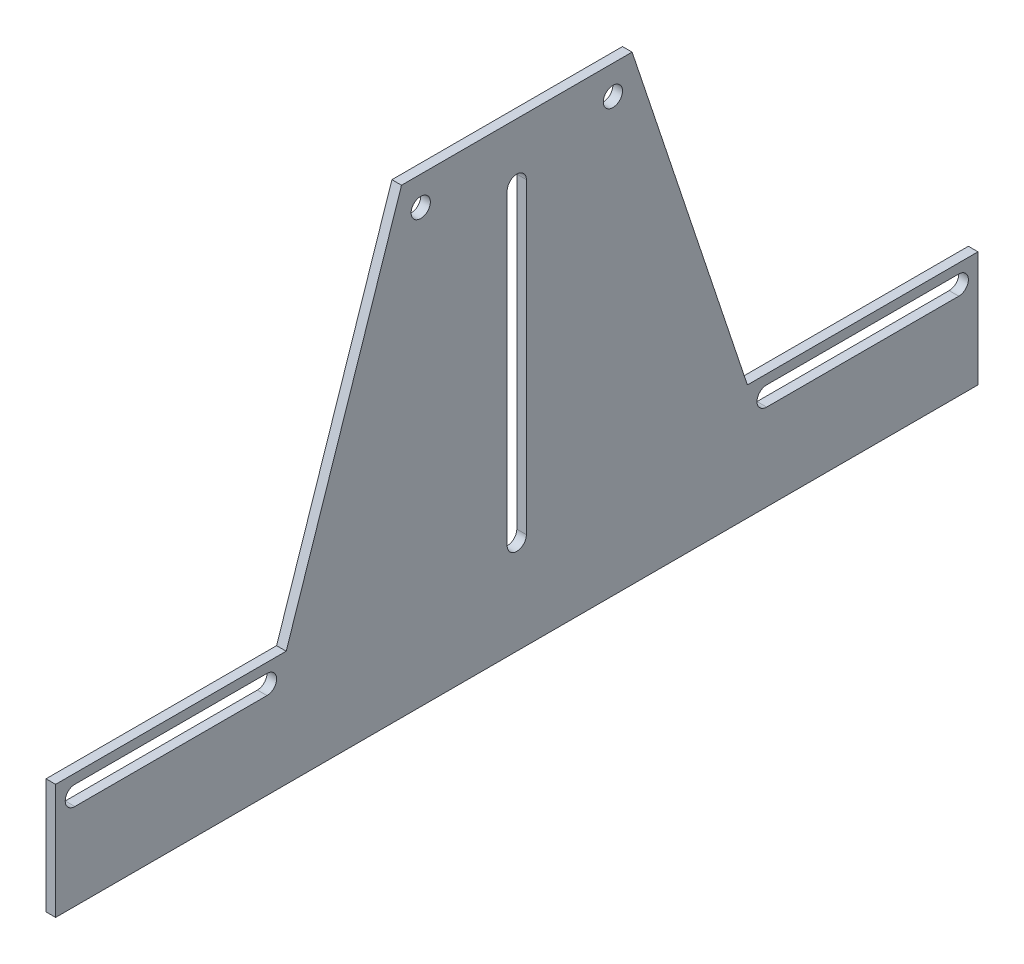
from build123d import *

# Parameters (mm, degrees)
SKETCH1_R           = 6.35
BOSS_EXTRUDE1_DEPTH = 6.35


with BuildPart() as part:
    # Sketch1 → Boss-Extrude1 (new body)
    with BuildSketch(Plane(origin=(0, 0, 0), x_dir=(0, 0, -1), z_dir=(1, 0, 0))):
        Polygon((304.8, 0), (-304.8, 0), (-304.8, 76.2), (-152.4, 76.2), (-76.2, 304.8), (76.2, 304.8), (152.4, 76.2), (304.8, 76.2), align=None)
        with Locations((-63.5, 285.75)):
            Circle(SKETCH1_R, mode=Mode.SUBTRACT)
        with Locations((63.5, 285.75)):
            Circle(SKETCH1_R, mode=Mode.SUBTRACT)
        with BuildLine():
            Line((-292.1, 69.85), (-165.1, 69.85))
            ThreePointArc((-165.1, 69.85), (-158.75, 63.5), (-165.1, 57.15))
            Line((-165.1, 57.15), (-292.1, 57.15))
            ThreePointArc((-292.1, 57.15), (-298.45, 63.5), (-292.1, 69.85))
        make_face(mode=Mode.SUBTRACT)
        with BuildLine():
            Line((292.1, 69.85), (165.1, 69.85))
            ThreePointArc((165.1, 69.85), (158.75, 63.5), (165.1, 57.15))
            Line((165.1, 57.15), (292.1, 57.15))
            ThreePointArc((292.1, 57.15), (298.45, 63.5), (292.1, 69.85))
        make_face(mode=Mode.SUBTRACT)
        with BuildLine():
            Line((6.35, 266.7), (6.35, 63.5))
            ThreePointArc((6.35, 63.5), (0, 57.15), (-6.35, 63.5))
            Line((-6.35, 63.5), (-6.35, 266.7))
            ThreePointArc((-6.35, 266.7), (0, 273.05), (6.35, 266.7))
        make_face(mode=Mode.SUBTRACT)
    extrude(amount=BOSS_EXTRUDE1_DEPTH)


solid = part.part
